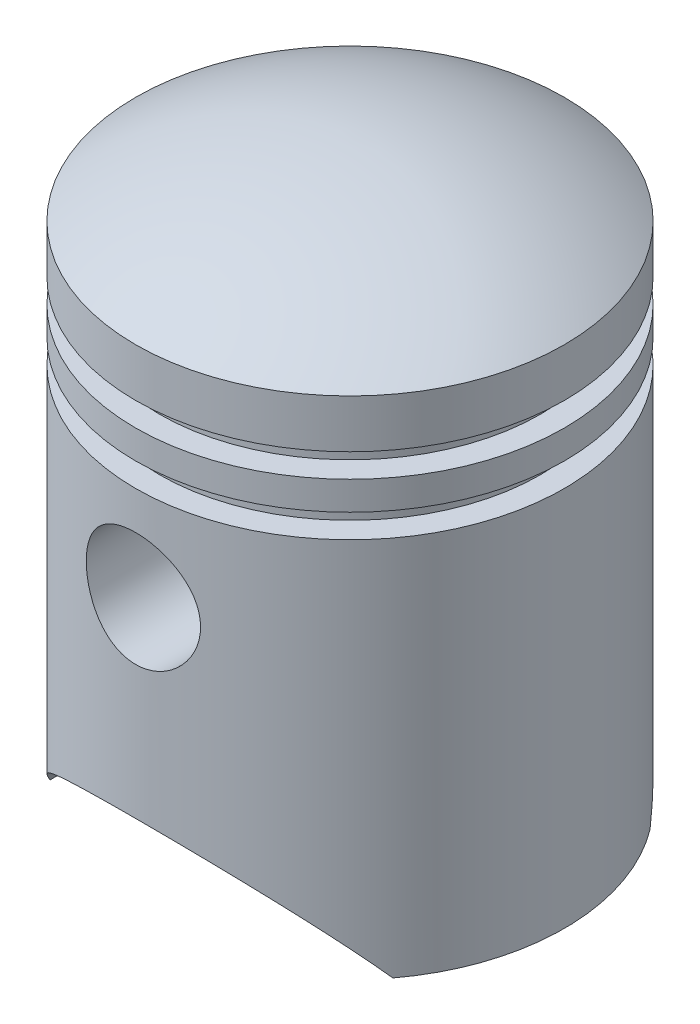
from build123d import *

# Parameters (mm, degrees)
SZKIC2_W                         = 2.5
SZKIC2_H                         = 2.5
SZYK_LINIOWY1_COUNT              = 2
SZYK_LINIOWY1_PITCH              = 5.5
WYTNIJ_WYCI_GNI_CIE1_DEPTH       = 68.915388536
WYTNIJ_WYCI_GNI_CIE1_DEPTH_BACK  = 68.915388536
WYTNIJ_WYCI_GNI_CIE2_DEPTH       = 68.915388602
WYTNIJ_WYCI_GNI_CIE2_DEPTH_BACK  = 68.915388602
SZKIC4_R                         = 6
DODANIE_WYCI_GNI_CIE7_REACH      = 79.915
DODANIE_WYCI_GNI_CIE7_END_RADIUS = 20.5
DODANIE_WYCI_GNI_CIE7_START      = 10
SZKIC6_R                         = 7.5
SZKIC6_R_2                       = 6


# Read off the part's stored shape, not the designer's step: Skorupa2
with BuildPart() as part:
    # Szkic1 → Obrót1 (revolve)
    with BuildSketch(Plane.XY):
        with BuildLine():
            Line((0, 0), (0, 60))
            ThreePointArc((0, 60), (11.771243445, 58.228756555), (22.5, 53.071891388))
            Line((22.5, 53.071891388), (22.5, 0))
            Line((22.5, 0), (0, 0))
        make_face()
    revolve(axis=Axis((0, 0, 0), (0, 1, 0)))

    # Szkic2 → Wycięcie-obrót1 (revolve, cut)
    with BuildSketch(Plane.XY, mode=Mode.PRIVATE) as wyci_cie_obr_t1_sk:
        with Locations((21.25, 41.25)):
            Rectangle(SZKIC2_W, SZKIC2_H)
    wyci_cie_obr_t1 = revolve(wyci_cie_obr_t1_sk.sketch.rotate(Axis((0, 69.339068265, 0), (0, 1, 0)), 90), axis=Axis((0, 69.339068265, 0), (0, 1, 0)), mode=Mode.SUBTRACT)

    # Szyk liniowy1: Wycięcie-obrót1 ×2
    with Locations(*[(0, i * SZYK_LINIOWY1_PITCH, 0) for i in range(1, SZYK_LINIOWY1_COUNT)]):
        add(wyci_cie_obr_t1, mode=Mode.SUBTRACT)

    # Skorupa2 outline → Skorupa2 (revolve, cut)
    with BuildSketch(Plane.XY):
        with BuildLine():
            Line((0, 0), (20.5, 0))
            Line((20.5, 0), (20.5, 38))
            Line((20.5, 38), (18, 38))
            Line((18, 38), (18, 50))
            Line((18, 50), (20.5, 50))
            Line((20.5, 50), (20.500000011, 51.996093505))
            ThreePointArc((20.500000011, 51.996093505), (10.680553516, 56.468147425), (0, 58))
            Line((0, 58), (0, 0))
        make_face()
    revolve(axis=Axis((0, 0, 0), (0, 1, 0)), mode=Mode.SUBTRACT)

    # Szkic3 → Wytnij-wyciągnięcie1 (cut, two sides: drawn at the far end of the back side and taken through both)
    with BuildSketch(Plane.XY.offset(-WYTNIJ_WYCI_GNI_CIE1_DEPTH_BACK)):
        with BuildLine():
            Line((99.770112831, -131.416252764), (18, 0))
            ThreePointArc((18, 0), (0, 10), (-18, 0))
            Line((-18, 0), (-99.770112831, -131.416252764))
            Line((-99.770112831, -131.416252764), (-99.770112831, -440.974537052))
            Line((-99.770112831, -440.974537052), (99.770112831, -440.974537052))
            Line((99.770112831, -440.974537052), (99.770112831, -131.416252764))
        make_face()
    extrude(amount=WYTNIJ_WYCI_GNI_CIE1_DEPTH + WYTNIJ_WYCI_GNI_CIE1_DEPTH_BACK, mode=Mode.SUBTRACT)

    # Szkic4 → Wytnij-wyciągnięcie2 (cut, two sides: drawn at the far end of the back side and taken through both)
    with BuildSketch(Plane.XY.offset(-WYTNIJ_WYCI_GNI_CIE2_DEPTH_BACK)):
        with Locations((0, 30)):
            Circle(SZKIC4_R)
    extrude(amount=WYTNIJ_WYCI_GNI_CIE2_DEPTH + WYTNIJ_WYCI_GNI_CIE2_DEPTH_BACK, mode=Mode.SUBTRACT)

    # Dodanie-wyciągnięcie7: up to this cylinder (the profile starts inside it)
    dodanie_wyci_gni_cie7_end = Plane(origin=(0, 30, 0), z_dir=(0, -1, 0)) * Cylinder(DODANIE_WYCI_GNI_CIE7_END_RADIUS, 201.83, mode=Mode.PRIVATE)
    # Szkic6 → Dodanie-wyciągnięcie7 (add, up to the surface)
    with BuildSketch(Plane.XY.offset(DODANIE_WYCI_GNI_CIE7_START), mode=Mode.PRIVATE) as dodanie_wyci_gni_cie7_sk1:
        with Locations(Location((0, 30, 0), (0, 0, 180))):
            Circle(SZKIC6_R)
        with Locations((0, 30)):
            Circle(SZKIC6_R_2, mode=Mode.SUBTRACT)
    dodanie_wyci_gni_cie7_tool1 = extrude(dodanie_wyci_gni_cie7_sk1.sketch, amount=DODANIE_WYCI_GNI_CIE7_REACH, mode=Mode.PRIVATE) & dodanie_wyci_gni_cie7_end
    dodanie_wyci_gni_cie7 = dodanie_wyci_gni_cie7_tool1.solids().sort_by_distance((7.287868, 30, 10))[0]
    add(dodanie_wyci_gni_cie7)

    # Lustro1: Dodanie-wyciągnięcie7 across plane
    add(dodanie_wyci_gni_cie7.mirror(Plane.XY))


solid = part.part
